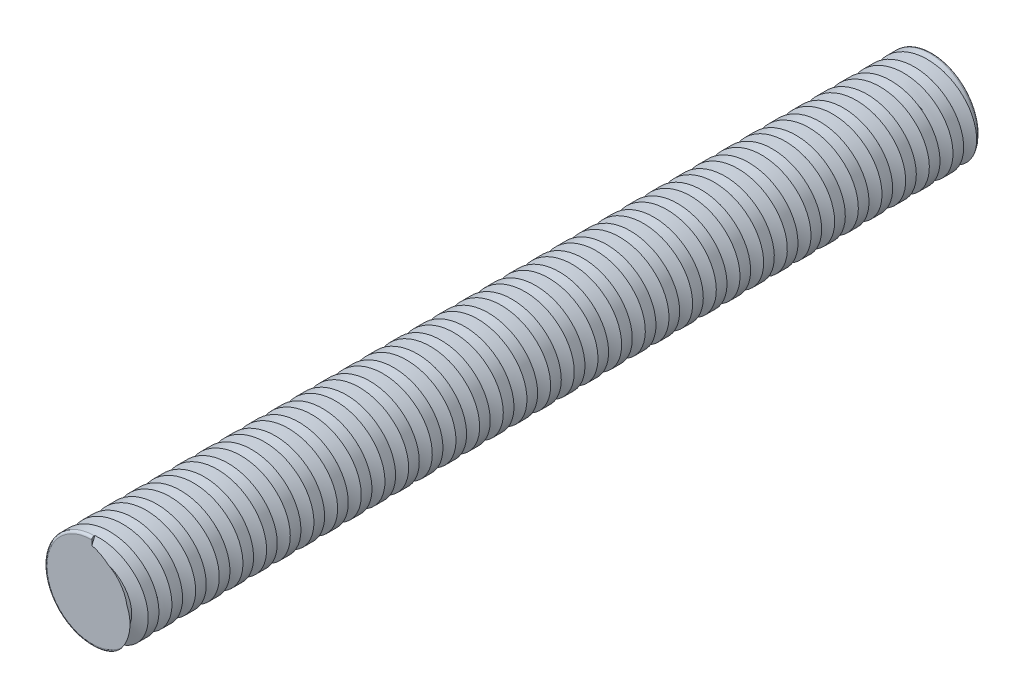
from build123d import *

# Parameters (mm, degrees)
SKETCH1_R           = 4
BOSS_EXTRUDE1_DEPTH = 71
FILLET1_R           = 0.2
CUT_SWEEP1_PITCH    = 2


with BuildPart() as part:
    # Sketch1 → Boss-Extrude1 (new body)
    with BuildSketch(Plane.XY):
        Circle(SKETCH1_R)
    extrude(amount=-BOSS_EXTRUDE1_DEPTH)

    # Fillet1
    fillet1_edges = [part.edges().sort_by_distance(p)[0] for p in [
        (-4, 0, 0),
        (-4, 0, -71),
    ]]
    fillet(fillet1_edges, radius=FILLET1_R)

    # Cut-Sweep1: arcs per turn and ends read off the stored shape
    # Cut-Sweep1: the profile of Sketch3 screwed along a right-hand helix through 35.5 turns, 10 arcs to a turn; built about Z, then put on its axis
    cut_sweep1_z = Axis((0, 0, 0), (0, 0, 1))
    cut_sweep1_corners = [(3, 1.047e-06, -0.149999889), (3, 1.047e-06, -0.449999889), (5, 1.745e-06, -1.249999889), (5, 1.745e-06, 0.650000111)]
    with BuildLine(mode=Mode.PRIVATE) as cut_sweep1_profile:
        Line(cut_sweep1_corners[0], cut_sweep1_corners[1])
        Line(cut_sweep1_corners[1], cut_sweep1_corners[2])
        Line(cut_sweep1_corners[2], cut_sweep1_corners[3])
        Line(cut_sweep1_corners[3], cut_sweep1_corners[0])
    cut_sweep1_cap = Face(cut_sweep1_profile.wire())
    cut_sweep1_turn_angles = [0, 18, 36, 54, 72, 90, 108, 126, 144, 162, 180, 198, 216, 234, 252, 270, 288, 306, 324, 342, 360]
    cut_sweep1_turn_weights = [1, 0.9510565162951535, 1, 0.9510565162951535, 1, 0.9510565162951535, 1, 0.9510565162951535, 1, 0.9510565162951535, 1, 0.9510565162951535, 1, 0.9510565162951535, 1, 0.9510565162951535, 1, 0.9510565162951535, 1, 0.9510565162951535, 1]
    cut_sweep1_turn_rails = [Edge.make_bspline([Vector(p[0], p[1], 0).rotate(cut_sweep1_z, cut_sweep1_turn_angles[k]) / cut_sweep1_turn_weights[k] + Vector(0, 0, p[2] + CUT_SWEEP1_PITCH * cut_sweep1_turn_angles[k] / 360) for k in range(21)], [0, 0, 0, 1, 1, 2, 2, 3, 3, 4, 4, 5, 5, 6, 6, 7, 7, 8, 8, 9, 9, 10, 10, 10], 2, cut_sweep1_turn_weights) for p in cut_sweep1_corners]
    cut_sweep1_turn_sides = [Face.make_surface_from_curves(cut_sweep1_turn_rails[p[0]], cut_sweep1_turn_rails[p[1]]) for p in [(0, 1), (1, 2), (2, 3), (3, 0)]]
    cut_sweep1_last_angles = [12600, 12618, 12636, 12654, 12672, 12690, 12708, 12726, 12744, 12762, 12780]
    cut_sweep1_last_weights = [1, 0.9510565162951535, 1, 0.9510565162951535, 1, 0.9510565162951535, 1, 0.9510565162951535, 1, 0.9510565162951095, 1]
    cut_sweep1_last_rails = [Edge.make_bspline([Vector(p[0], p[1], 0).rotate(cut_sweep1_z, cut_sweep1_last_angles[k]) / cut_sweep1_last_weights[k] + Vector(0, 0, p[2] + CUT_SWEEP1_PITCH * cut_sweep1_last_angles[k] / 360) for k in range(11)], [0, 0, 0, 1, 1, 2, 2, 3, 3, 4, 4, 5, 5, 5], 2, cut_sweep1_last_weights) for p in cut_sweep1_corners]
    cut_sweep1_last_sides = [Face.make_surface_from_curves(cut_sweep1_last_rails[p[0]], cut_sweep1_last_rails[p[1]]) for p in [(0, 1), (1, 2), (2, 3), (3, 0)]]
    cut_sweep1 = Plane(origin=(0, 0, 0), x_dir=(0, 1, 0), z_dir=(0, 0, -1)) * Solid(Shell([*[p.moved(Location((0, 0, CUT_SWEEP1_PITCH * i))) for i in range(35) for p in cut_sweep1_turn_sides], *cut_sweep1_last_sides, cut_sweep1_cap, cut_sweep1_cap.rotate(cut_sweep1_z, 12780).moved(Location((0, 0, CUT_SWEEP1_PITCH * 12780 / 360)))]))
    add(cut_sweep1, mode=Mode.SUBTRACT)


solid = part.part
